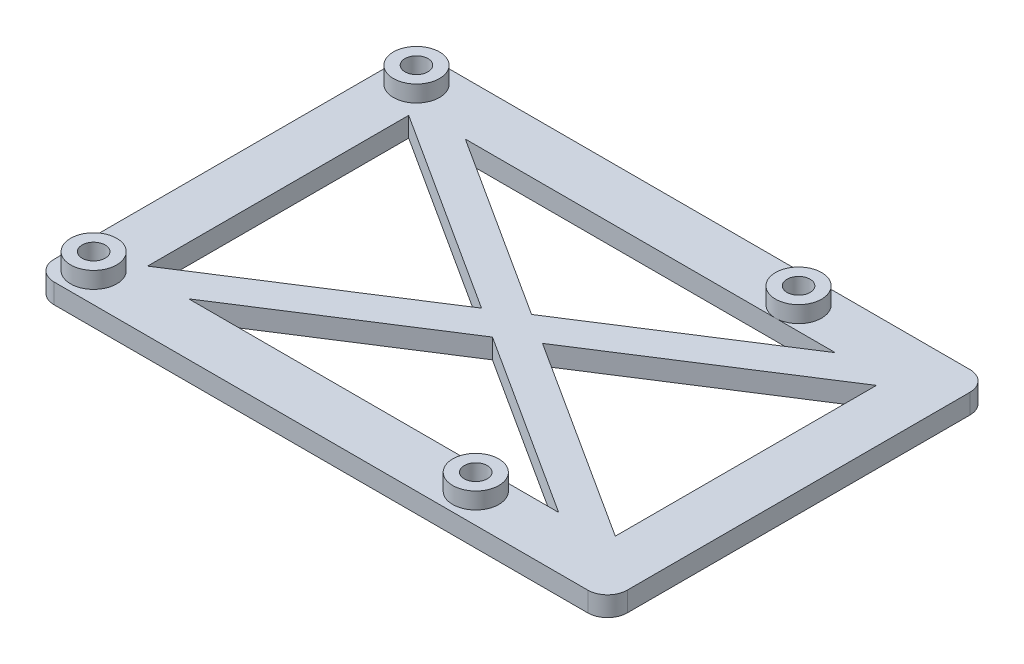
from build123d import *

# Parameters (mm, degrees)
CROQUIS1_W              = 87
CROQUIS1_H              = 58
SALIENTE_EXTRUIR1_DEPTH = 3
CROQUIS2_R              = 1.75
CORTAR_EXTRUIR1_DEPTH   = 53.366496923
CROQUIS3_R              = 3.5
CROQUIS3_R_2            = 1.75
SALIENTE_EXTRUIR2_DEPTH = 2.5
REDONDEO1_R             = 3
CORTAR_EXTRUIR2_DEPTH   = 53.569002273


with BuildPart() as part:
    # Croquis1 → Saliente-Extruir1 (new body)
    with BuildSketch(Plane(origin=(0, 0, 0), x_dir=(1, 0, 0), z_dir=(0, 1, 0))):
        Rectangle(CROQUIS1_W, CROQUIS1_H)
    extrude(amount=SALIENTE_EXTRUIR1_DEPTH)

    # Croquis2 → Cortar-Extruir1 (cut, through all)
    with BuildSketch(Plane.XZ):
        with Locations((-39, -24.5)):
            Circle(CROQUIS2_R)
        with Locations((-39, 24.5)):
            Circle(CROQUIS2_R)
        with Locations((19, 24.5)):
            Circle(CROQUIS2_R)
        with Locations((19, -24.5)):
            Circle(CROQUIS2_R)
    extrude(amount=-CORTAR_EXTRUIR1_DEPTH, mode=Mode.SUBTRACT)

    # Croquis3 → Saliente-Extruir2 (add)
    # profile 1 of 2: a face of its own
    with BuildSketch(Plane(origin=(0, 3, 0), x_dir=(1, 0, 0), z_dir=(0, 1, 0))):
        with Locations((-39, 24.5)):
            Circle(CROQUIS3_R)
        with Locations((-39, 24.5)):
            Circle(CROQUIS3_R_2, mode=Mode.SUBTRACT)
    # profile 2 of 2: a face of its own
    with BuildSketch(Plane(origin=(0, 3, 0), x_dir=(1, 0, 0), z_dir=(0, 1, 0))):
        with Locations((19, 24.5)):
            Circle(CROQUIS3_R)
        with Locations((19, 24.5)):
            Circle(CROQUIS3_R_2, mode=Mode.SUBTRACT)
    saliente_extruir2 = extrude(amount=SALIENTE_EXTRUIR2_DEPTH)

    # Simetría1: Saliente-Extruir2 across plane
    add(saliente_extruir2.mirror(Plane.XY))

    # Redondeo1
    redondeo1_edges = [part.edges().sort_by_distance(p)[0] for p in [
        (-43.5, 1.5, -29),
        (-43.5, 1.5, 29),
        (43.5, 1.5, 29),
        (43.5, 1.5, -29),
    ]]
    fillet(redondeo1_edges, radius=REDONDEO1_R)

    # Croquis4 → Cortar-Extruir2 (cut, through all)
    with BuildSketch(Plane.XZ):
        Polygon((28.08390048, 21), (0, 2.970829321), (-28.08390048, 21), align=None)
        Polygon((35.5, 19.819294136), (35.5, -19.819294136), (4.627637981, 0), align=None)
        Polygon((0, -2.970829321), (-28.08390048, -21), (28.08390048, -21), align=None)
        Polygon((-35.5, -19.819294136), (-35.5, 19.819294136), (-4.627637981, 0), align=None)
    extrude(amount=-CORTAR_EXTRUIR2_DEPTH, mode=Mode.SUBTRACT)


solid = part.part
